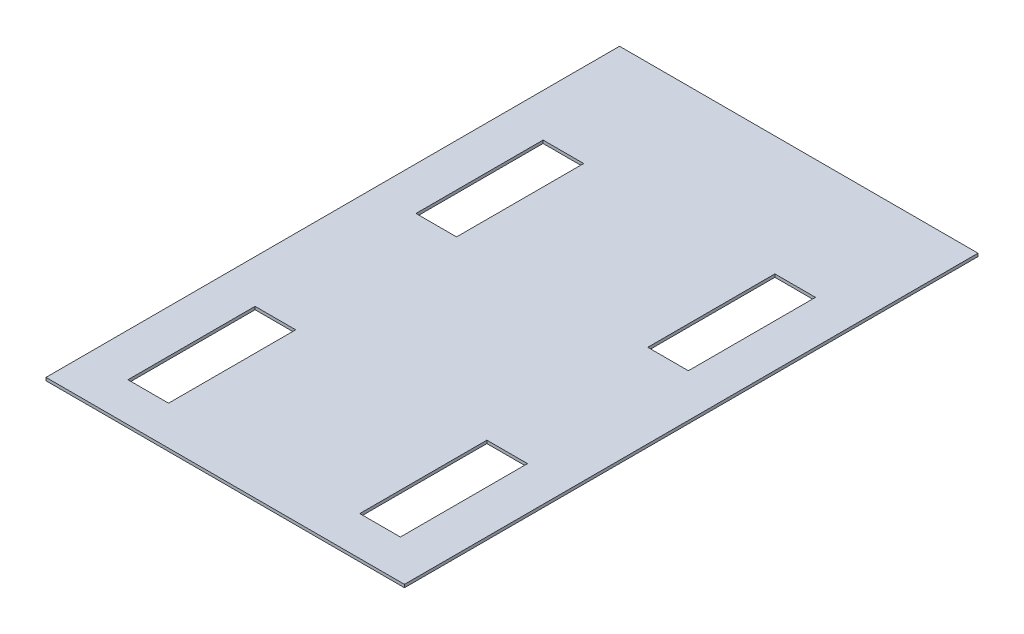
from build123d import *

# Parameters (mm, degrees)
SKETCH1_W           = 381
SKETCH1_H           = 609.6
BOSS_EXTRUDE1_DEPTH = 3.175
SKETCH2_W           = 43.18
SKETCH2_H           = 135.128
CUT_EXTRUDE1_DEPTH  = 360.448703746


with BuildPart() as part:
    # Sketch1 → Boss-Extrude1 (new body)
    with BuildSketch(Plane(origin=(0, 0, 0), x_dir=(1, 0, 0), z_dir=(0, 1, 0))):
        Rectangle(SKETCH1_W, SKETCH1_H)
    extrude(amount=BOSS_EXTRUDE1_DEPTH)

    # Sketch2 → Cut-Extrude1 (cut, through all)
    with BuildSketch(Plane(origin=(0, 3.175, 0), x_dir=(1, 0, 0), z_dir=(0, 1, 0))):
        with Locations((123.19, -195.8594)):
            Rectangle(SKETCH2_W, SKETCH2_H)
        with Locations((123.19, 110.236)):
            Rectangle(SKETCH2_W, SKETCH2_H)
        with Locations((-123.19, -195.8594)):
            Rectangle(SKETCH2_W, SKETCH2_H)
        with Locations((-123.19, 110.236)):
            Rectangle(SKETCH2_W, SKETCH2_H)
    extrude(amount=-CUT_EXTRUDE1_DEPTH, mode=Mode.SUBTRACT)


solid = part.part
